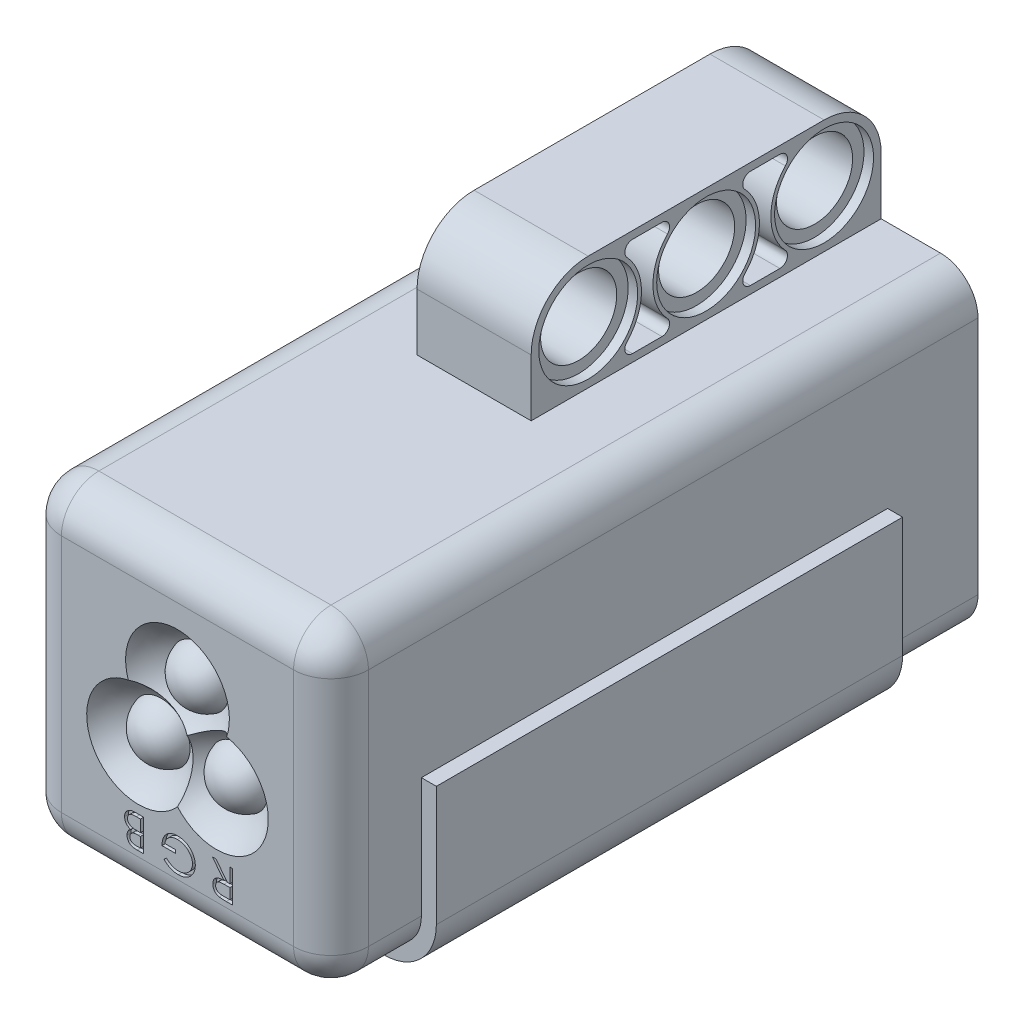
from build123d import *
from build123d.topology import SkipClean

# Parameters (mm, degrees)
SKETCH1_W                         = 20.5
SKETCH1_H                         = 21
BOSS_EXTRUDE1_DEPTH               = 21.6
FILLET1_R                         = 2.5
SKETCH2_W                         = 12.5
SKETCH2_H                         = 15
CUT_EXTRUDE1_DEPTH                = 12
BOSS_EXTRUDE5_DEPTH               = 15.565
CIRPATTERN1_COUNT                 = 3
CUT_EXTRUDE2_DEPTH                = 0.25
PROXIMITY_START                   = -1.992044947
PROXIMITY_SENSOR_PART_OUTLINE_R   = 2.54
PROXIMITY_SENSOR_PART_DEPTH       = 6.35
PROXIMITY_START_2                 = -2.627044947
PROXIMITY_SENSOR_PART_2_OUTLINE_R = 3.302
PROXIMITY_SENSOR_PART_2_DEPTH     = 7.62
BODY_MOVE_COPY4_START             = -11.585761931
BODY_MOVE_COPY4_DEPTH             = 23.368
BODY_MOVE_COPY4_START_2           = 3.783
BODY_MOVE_COPY4_2_DEPTH           = 7.999238069
BODY_MOVE_COPY4_3_DEPTH           = 7.748761931
BODY_MOVE_COPY4_START_3           = 3.148
BODY_MOVE_COPY4_4_DEPTH           = 0.635
BODY_MOVE_COPY4_START_4           = -3.837
BODY_MOVE_COPY4_5_DEPTH           = 0.635
BODY_MOVE_COPY4_START_5           = -3.202
BODY_MOVE_COPY4_6_OUTLINE_R       = 2.54
BODY_MOVE_COPY4_6_DEPTH           = 6.35
BODY_MOVE_COPY4_7_OUTLINE_R       = 3.302
BODY_MOVE_COPY4_7_DEPTH           = 7.62


# Read off the part's stored shape, not the designer's step: Proximity sensor - part, Body-Move/Copy4
with BuildPart() as part:
    # Sketch1 → Boss-Extrude1 (new, symmetric)
    with BuildSketch(Plane.XY):
        Rectangle(SKETCH1_W, SKETCH1_H)
    extrude(amount=BOSS_EXTRUDE1_DEPTH, both=True)

    # Fillet1
    fillet1_edges = [part.edges().sort_by_distance(p)[0] for p in [
        (-10.25, 0, 21.6),
        (0, -10.5, 21.6),
        (10.25, 0, 21.6),
        (0, 10.5, 21.6),
        (10.25, -10.5, 0),
        (-10.25, -10.5, 0),
        (-10.25, 10.5, 0),
        (10.25, 10.5, 0),
    ]]
    fillet(fillet1_edges, radius=FILLET1_R)

    # Sketch2 → Cut-Extrude1 (cut)
    with BuildSketch(Plane(origin=(0, 0, -21.6), x_dir=(-1, 0, 0), z_dir=(0, 0, -1))):
        with Locations((0, 1.5)):
            Rectangle(SKETCH2_W, SKETCH2_H)
    extrude(amount=-CUT_EXTRUDE1_DEPTH, mode=Mode.SUBTRACT)

    # Sketch5 → Boss-Extrude5 (add, symmetric)
    with BuildSketch(Plane.XY):
        with BuildLine():
            Line((10.25, -8), (10.25, 0))
            Line((10.25, 0), (11.25, 0))
            Line((11.25, 0), (11.25, -8))
            ThreePointArc((11.25, -8), (10.224873734, -10.474873734), (7.75, -11.5))
            Line((7.75, -11.5), (-7.75, -11.5))
            ThreePointArc((-7.75, -11.5), (-10.224873734, -10.474873734), (-11.25, -8))
            Line((-11.25, -8), (-11.25, 0))
            Line((-11.25, 0), (-10.25, 0))
            Line((-10.25, 0), (-10.25, -8))
            ThreePointArc((-10.25, -8), (-9.517766953, -9.767766953), (-7.75, -10.5))
            Line((-7.75, -10.5), (7.75, -10.5))
            ThreePointArc((7.75, -10.5), (9.517766953, -9.767766953), (10.25, -8))
        make_face()
    extrude(amount=BOSS_EXTRUDE5_DEPTH, both=True)

    # Sketch6 → Cut-Revolve1 (revolve, cut)
    with BuildSketch(Plane.XY.offset(23.6)):
        with BuildLine():
            Line((0, -1), (0, 7))
            ThreePointArc((0, 7), (-4, 3), (0, -1))
        make_face()
    cut_revolve1 = revolve(axis=Axis((0, -1, 23.6), (0, 1, 0)), mode=Mode.SUBTRACT)

    # Sketch7 → Revolve2 (revolve)
    with BuildSketch(Plane(origin=(0, 0, 0), x_dir=(0, 0, -1), z_dir=(1, 0, 0)), mode=Mode.PRIVATE) as revolve2_sk:
        with BuildLine():
            Line((-16.6, 3), (-21.6, 3))
            ThreePointArc((-21.6, 3), (-21.014213562, 4.414213562), (-19.6, 5))
            Line((-19.6, 5), (-16.6, 5))
            Line((-16.6, 5), (-16.6, 3))
        make_face()
    revolve2 = revolve(revolve2_sk.sketch.rotate(Axis((0, 3, 16.6), (0, 0, 1)), 90), axis=Axis((0, 3, 16.6), (0, 0, 1)))

    # CirPattern1: Cut-Revolve1, Revolve2 ×3 about axis
    cirpattern1_axis = Axis((0, 0, 0), (0, 0, 1))
    add([cut_revolve1.rotate(cirpattern1_axis, i * 360 / CIRPATTERN1_COUNT) for i in range(1, CIRPATTERN1_COUNT)], mode=Mode.SUBTRACT)
    add([revolve2.rotate(cirpattern1_axis, i * 360 / CIRPATTERN1_COUNT) for i in range(1, CIRPATTERN1_COUNT)])

    # Sketch8 → Cut-Extrude2 (cut)
    # profile 1 of 3: a face of its own
    with BuildSketch(Plane.XY.offset(21.6)):
        with BuildLine():
            Line((3.686256134, -7.638960054), (3.262668393, -7.638960054))
            add(Edge.make_bspline(
                [(3.262668393, -7.638960054), (3.234401139, -7.638865961), (3.180124881, -7.638685293), (3.102368665, -7.637677903), (3.031716087, -7.634790555), (2.968204089, -7.63230584), (2.911833836, -7.627774999), (2.862432474, -7.623444513), (2.820227533, -7.61777568), (2.794678852, -7.612510972), (2.783111102, -7.610127255)],
                knots=[0, 0, 0, 0, 1.410062039, 2.707475311, 3.878576406, 4.937260626, 5.877586885, 6.699081471, 7.410979367, 8, 8, 8, 8], degree=3))
            add(Edge.make_bspline(
                [(2.783111102, -7.610127255), (2.76762493, -7.606301492), (2.736982949, -7.598731579), (2.692869311, -7.582723674), (2.65081574, -7.564228768), (2.610976238, -7.542339896), (2.573361243, -7.517426679), (2.537974547, -7.489388965), (2.505290614, -7.457986528), (2.4741466, -7.42452018), (2.446951928, -7.387532838), (2.422469508, -7.348901512), (2.401917356, -7.307882452), (2.385745106, -7.264682548), (2.372187435, -7.219725571), (2.363075414, -7.172567284), (2.357400288, -7.123361117), (2.356839585, -7.08988072), (2.356555279, -7.072904365)],
                knots=[0, 0, 0, 0, 1.027276577, 2.032638556, 3.019345632, 3.985365262, 4.957888996, 5.923693931, 6.890056973, 7.876427719, 8.865527834, 9.843495157, 10.821038291, 11.815616373, 12.812734995, 13.843357168, 14.906466538, 16, 16, 16, 16], degree=3))
            add(Edge.make_bspline(
                [(2.356555279, -7.072904365), (2.35744365, -7.044701197), (2.359177092, -6.989669514), (2.375339739, -6.909804577), (2.401812932, -6.835302714), (2.438298498, -6.766267607), (2.484739933, -6.704008567), (2.540551978, -6.649509376), (2.605449603, -6.603482326), (2.666148681, -6.571903714), (2.719792504, -6.551584681), (2.764085066, -6.537216365), (2.812437452, -6.526302241), (2.864155973, -6.516382827), (2.919640108, -6.508813518), (2.978778126, -6.503437869), (3.041717934, -6.499981286), (3.084861505, -6.499476265), (3.10705608, -6.499216464)],
                knots=[0, 0, 0, 0, 1.260402266, 2.459371274, 3.627181936, 4.786749125, 5.93865593, 7.087644312, 8.261344208, 9.485713728, 10.136162886, 10.825977872, 11.566646758, 12.35154167, 13.181268117, 14.0701832, 15.007234106, 16, 16, 16, 16], degree=3))
            Line((3.10705608, -6.499216464), (2.329418527, -5.522293387))
            Line((2.329418527, -5.522293387), (2.564321038, -5.522293387))
            Line((2.564321038, -5.522293387), (3.341958591, -6.499216464))
            Line((3.341958591, -6.499216464), (3.496298869, -6.499216464))
            Line((3.496298869, -6.499216464), (3.496298869, -5.522293387))
            Line((3.496298869, -5.522293387), (3.686256134, -5.522293387))
            Line((3.686256134, -5.522293387), (3.686256134, -7.638960054))
        make_face()
        with BuildLine():
            Line((3.496298869, -7.421866037), (3.496298869, -6.716310481))
            Line((3.496298869, -6.716310481), (3.108752127, -6.713342399))
            add(Edge.make_bspline(
                [(3.108752127, -6.713342399), (3.090657625, -6.713334389), (3.055585327, -6.713318864), (3.004845432, -6.71573421), (2.957601259, -6.718481624), (2.914034107, -6.72268503), (2.874122555, -6.728099), (2.837892963, -6.734881709), (2.80526527, -6.742750427), (2.767333006, -6.755053775), (2.724488451, -6.773705721), (2.678886186, -6.802627184), (2.639008311, -6.83760343), (2.605854261, -6.878104047), (2.57922489, -6.922825098), (2.56072842, -6.97075448), (2.548539355, -7.021137018), (2.547195937, -7.055730678), (2.546512544, -7.073328376)],
                knots=[0, 0, 0, 0, 1.146399208, 2.222048177, 3.218135709, 4.144938032, 4.994811973, 5.769438708, 6.479732432, 7.119818093, 8.294689872, 9.430121864, 10.527913442, 11.641375077, 12.733452768, 13.811150417, 14.886538365, 16, 16, 16, 16], degree=3))
            add(Edge.make_bspline(
                [(2.546512544, -7.073328376), (2.547230539, -7.090353681), (2.548653345, -7.124091622), (2.560534344, -7.173371936), (2.579934135, -7.220231046), (2.606487469, -7.264024142), (2.639535941, -7.303482339), (2.678029968, -7.337140238), (2.7210637, -7.365102261), (2.760958769, -7.383551672), (2.796878382, -7.394407334), (2.827921743, -7.402287447), (2.863303906, -7.407806321), (2.902608428, -7.412882211), (2.94600797, -7.417180712), (2.993528982, -7.420033846), (3.045137483, -7.421739168), (3.080907284, -7.421822763), (3.099423869, -7.421866037)],
                knots=[0, 0, 0, 0, 1.100596872, 2.180981401, 3.259506136, 4.371595435, 5.481727359, 6.576991111, 7.667816242, 8.793363246, 9.406619729, 10.09427138, 10.864108636, 11.721733836, 12.6590937, 13.685439239, 14.801845161, 16, 16, 16, 16], degree=3))
            Line((3.099423869, -7.421866037), (3.496298869, -7.421866037))
        make_face(mode=Mode.SUBTRACT)
    # profile 2 of 3: a face of its own
    with BuildSketch(Plane.XY.offset(21.6)):
        with BuildLine():
            Line((-0.899854977, -7.277702041), (-0.737034465, -7.123361763))
            add(Edge.make_bspline(
                [(-0.737034465, -7.123361763), (-0.707398613, -7.151040463), (-0.648990924, -7.205590908), (-0.554221788, -7.277158634), (-0.455208135, -7.337989157), (-0.352754953, -7.387966069), (-0.248837924, -7.42681488), (-0.145531754, -7.454904619), (-0.043560717, -7.472969752), (0.024136732, -7.475091761), (0.057563559, -7.476139541)],
                knots=[0, 0, 0, 0, 1.091957225, 2.152079168, 3.193085318, 4.218301889, 5.218403563, 6.17723952, 7.099979378, 8, 8, 8, 8], degree=3))
            add(Edge.make_bspline(
                [(0.057563559, -7.476139541), (0.078073762, -7.475889038), (0.119040975, -7.475388683), (0.179895007, -7.469017441), (0.240102684, -7.459825671), (0.299456382, -7.446662968), (0.358192085, -7.429566843), (0.416179127, -7.408925822), (0.473305594, -7.384078435), (0.529270957, -7.35575014), (0.583804102, -7.324825145), (0.635092814, -7.290334619), (0.683350975, -7.253339937), (0.728237324, -7.213355922), (0.770366705, -7.171048061), (0.808967919, -7.12581521), (0.844885119, -7.078326857), (0.876774878, -7.02790229), (0.905598513, -6.97597424), (0.930557326, -6.922956641), (0.95204831, -6.869223416), (0.969220918, -6.814744273), (0.983027038, -6.759554001), (0.992799189, -6.703738829), (0.998287941, -6.647023756), (0.999239373, -6.609046622), (0.999717672, -6.589954979)],
                knots=[0, 0, 0, 0, 1.028307134, 2.053947307, 3.065600992, 4.082111276, 5.100671203, 6.132125737, 7.167228006, 8.222953114, 9.277225349, 10.309459149, 11.320441984, 12.324791754, 13.322338422, 14.312705492, 15.305176196, 16.306142747, 17.302479595, 18.282363326, 19.243345101, 20.20291386, 21.145121196, 22.094978082, 23.042318507, 24, 24, 24, 24], degree=3))
            add(Edge.make_bspline(
                [(0.999717672, -6.589954979), (0.999256273, -6.570440007), (0.998334733, -6.531463352), (0.992557797, -6.473271089), (0.981474952, -6.416061716), (0.967937392, -6.359295525), (0.948775345, -6.30369706), (0.926500061, -6.248452102), (0.899641063, -6.194074086), (0.868712328, -6.14094205), (0.834532755, -6.089236337), (0.796947369, -6.04012172), (0.755885186, -5.994172187), (0.712101154, -5.950715938), (0.665195799, -5.910027397), (0.614714194, -5.872596956), (0.561362948, -5.837845838), (0.505118404, -5.806155808), (0.446575045, -5.777848496), (0.386548536, -5.752675759), (0.324845948, -5.731944973), (0.26179186, -5.715049058), (0.197461353, -5.701199834), (0.131527912, -5.692290191), (0.064476321, -5.685824784), (0.019277244, -5.685352059), (-0.003494133, -5.6851139)],
                knots=[0, 0, 0, 0, 0.935896426, 1.86923723, 2.799743935, 3.728471844, 4.66505513, 5.616527375, 6.583419551, 7.570341864, 8.562833498, 9.553750335, 10.533080376, 11.5155245, 12.510142773, 13.507781369, 14.526649666, 15.561487327, 16.601173999, 17.643331812, 18.680652164, 19.71969803, 20.772446191, 21.833473655, 22.9085001, 24, 24, 24, 24], degree=3))
            add(Edge.make_bspline(
                [(-0.003494133, -5.6851139), (-0.030937341, -5.685687325), (-0.084826538, -5.686813338), (-0.164040561, -5.695585937), (-0.240127245, -5.709269561), (-0.312838859, -5.729371286), (-0.382439408, -5.754815052), (-0.448671736, -5.78628013), (-0.511720415, -5.823434408), (-0.571306276, -5.865529418), (-0.626035808, -5.912418867), (-0.675781864, -5.962606597), (-0.719086714, -6.016493059), (-0.756232775, -6.074066524), (-0.788204837, -6.134479245), (-0.813708531, -6.198766684), (-0.833434408, -6.266210785), (-0.841504025, -6.312836648), (-0.845581473, -6.336395951)],
                knots=[0, 0, 0, 0, 1.130234505, 2.219399076, 3.279128566, 4.311639422, 5.322903917, 6.328167287, 7.327698761, 8.334124803, 9.329374007, 10.292761544, 11.24113083, 12.171311216, 13.111441694, 14.052040787, 15.015727358, 16, 16, 16, 16], degree=3))
            Line((-0.845581473, -6.336395951), (-0.140025918, -6.336395951))
            Line((-0.140025918, -6.336395951), (-0.140025918, -6.553489968))
            Line((-0.140025918, -6.553489968), (-1.035538738, -6.553489968))
            add(Edge.make_bspline(
                [(-1.035538738, -6.553489968), (-1.034507106, -6.513026868), (-1.032488016, -6.433833271), (-1.018325148, -6.318341726), (-0.995455162, -6.209259798), (-0.964212973, -6.106472607), (-0.923769351, -6.010125815), (-0.874558346, -5.920121601), (-0.815792349, -5.837041417), (-0.749564606, -5.76020702), (-0.675239393, -5.69166983), (-0.594825037, -5.631431953), (-0.50818868, -5.580690847), (-0.415412273, -5.539409399), (-0.316799534, -5.507191317), (-0.212122276, -5.484348506), (-0.101522451, -5.470662766), (-0.025723603, -5.46891417), (0.013042325, -5.468019883)],
                knots=[0, 0, 0, 0, 1.140356446, 2.231883559, 3.274166699, 4.278491846, 5.25512956, 6.21435461, 7.1637429, 8.11826594, 9.068280886, 10.0076534, 10.945064095, 11.891975133, 12.864533718, 13.863980011, 14.907571808, 16, 16, 16, 16], degree=3))
            add(Edge.make_bspline(
                [(0.013042325, -5.468019883), (0.03693655, -5.468364066), (0.084063662, -5.469042905), (0.153666271, -5.473867301), (0.221349784, -5.481294126), (0.287104342, -5.49250951), (0.351171815, -5.506246467), (0.413232231, -5.523837007), (0.473521999, -5.544198554), (0.532134304, -5.567358318), (0.588537149, -5.594192606), (0.642981757, -5.624013197), (0.695769081, -5.656666325), (0.746539547, -5.692716693), (0.79555769, -5.731894657), (0.842507439, -5.774278742), (0.887651632, -5.819739371), (0.915930579, -5.852020963), (0.930179745, -5.868286977)],
                knots=[0, 0, 0, 0, 1.107784379, 2.184907829, 3.233506516, 4.263428166, 5.276301166, 6.270063455, 7.25232949, 8.225834625, 9.190232166, 10.146266622, 11.1027726, 12.066435141, 13.031522626, 14.010570082, 14.99756817, 16, 16, 16, 16], degree=3))
            add(Edge.make_bspline(
                [(0.930179745, -5.868286977), (0.950854094, -5.894092562), (0.99185962, -5.945275387), (1.044642124, -6.027281068), (1.089637258, -6.112190764), (1.126145417, -6.200240849), (1.154652736, -6.291348963), (1.17509747, -6.385398687), (1.187076164, -6.48251113), (1.188801875, -6.548227743), (1.189674937, -6.581474744)],
                knots=[0, 0, 0, 0, 1.023165419, 2.029347347, 3.013907458, 3.994755782, 4.975994455, 5.96558838, 6.970761222, 8, 8, 8, 8], degree=3))
            add(Edge.make_bspline(
                [(1.189674937, -6.581474744), (1.189352188, -6.606370264), (1.188710791, -6.655844896), (1.180967237, -6.729301499), (1.169790768, -6.801435609), (1.153602082, -6.872314017), (1.132301829, -6.941622052), (1.106721044, -7.009892274), (1.07675867, -7.076851811), (1.041793678, -7.141907182), (1.003734688, -7.20503614), (0.960937955, -7.264251688), (0.915780912, -7.320698808), (0.866100138, -7.372779373), (0.813757285, -7.422157149), (0.7574504, -7.467530687), (0.69810328, -7.509665524), (0.635236718, -7.547737151), (0.569847902, -7.581947419), (0.502077563, -7.611936351), (0.431950709, -7.636721697), (0.359991563, -7.6577515), (0.285655755, -7.673303052), (0.209482641, -7.684581099), (0.131075193, -7.692298225), (0.078076261, -7.692918865), (0.051203383, -7.693233558)],
                knots=[0, 0, 0, 0, 1.009025537, 2.005226976, 2.991671811, 3.967589759, 4.950148279, 5.929425679, 6.922109907, 7.921964004, 8.922507644, 9.908469609, 10.882248289, 11.851158214, 12.824245259, 13.798023939, 14.780666017, 15.773333703, 16.775582742, 17.771174102, 18.775387309, 19.789283316, 20.80873549, 21.851817535, 22.910773411, 24, 24, 24, 24], degree=3))
            add(Edge.make_bspline(
                [(0.051203383, -7.693233558), (0.029287713, -7.692883979), (-0.014168484, -7.692190806), (-0.078830748, -7.687361272), (-0.142366236, -7.679791343), (-0.205093669, -7.669206064), (-0.266774206, -7.655203457), (-0.327594719, -7.63813833), (-0.387440177, -7.618380211), (-0.446239383, -7.594797843), (-0.504392107, -7.568035863), (-0.562220498, -7.537910348), (-0.619527296, -7.503907678), (-0.67641179, -7.465926472), (-0.733232715, -7.424619173), (-0.789091331, -7.37880433), (-0.845335969, -7.330288664), (-0.881501828, -7.295404677), (-0.899854977, -7.277702041)],
                knots=[0, 0, 0, 0, 0.985875312, 1.954874891, 2.915472732, 3.863573565, 4.815313299, 5.759461513, 6.704487138, 7.649063459, 8.607849844, 9.583336382, 10.581114205, 11.603942397, 12.659508253, 13.739925933, 14.853076422, 16, 16, 16, 16], degree=3))
        make_face()
    # profile 3 of 3: a face of its own
    with BuildSketch(Plane.XY.offset(21.6)):
        with BuildLine():
            Line((-2.283829336, -7.638960054), (-2.696816783, -7.638960054))
            add(Edge.make_bspline(
                [(-2.696816783, -7.638960054), (-2.717033372, -7.63885544), (-2.756218153, -7.638652672), (-2.813194149, -7.635434895), (-2.866578678, -7.631157166), (-2.916277402, -7.623981504), (-2.962613703, -7.61654129), (-3.005117171, -7.605620836), (-3.044143825, -7.593558797), (-3.091006849, -7.574999714), (-3.14417937, -7.546177223), (-3.201329882, -7.503430729), (-3.251008593, -7.452181136), (-3.293250224, -7.393778182), (-3.327150031, -7.329528314), (-3.351364779, -7.260813889), (-3.366921255, -7.188790945), (-3.368501029, -7.139412558), (-3.369299422, -7.114457516)],
                knots=[0, 0, 0, 0, 1.00128172, 1.940733171, 2.826250472, 3.653024905, 4.427672124, 5.149348099, 5.824709082, 6.450061444, 7.643590664, 8.808605388, 9.972104426, 11.165284501, 12.367876273, 13.557044126, 14.765369432, 16, 16, 16, 16], degree=3))
            add(Edge.make_bspline(
                [(-3.369299422, -7.114457516), (-3.368647284, -7.091078938), (-3.367365771, -7.045137827), (-3.354846424, -6.978168895), (-3.335948774, -6.914219569), (-3.308678317, -6.853906125), (-3.273906192, -6.797758536), (-3.231600678, -6.746734537), (-3.181437933, -6.701835896), (-3.143775467, -6.676849164), (-3.124644641, -6.664157036)],
                knots=[0, 0, 0, 0, 1.044356178, 2.052258378, 3.035953355, 4.020338374, 5.002448483, 5.980768927, 6.974322109, 8, 8, 8, 8], degree=3))
            add(Edge.make_bspline(
                [(-3.124644641, -6.664157036), (-3.148691939, -6.654929485), (-3.194700378, -6.637274895), (-3.258095864, -6.605940894), (-3.312733804, -6.572121601), (-3.359318331, -6.535569131), (-3.398352874, -6.495089941), (-3.433126412, -6.451750079), (-3.462637644, -6.404040164), (-3.48781731, -6.352994048), (-3.507763606, -6.29888205), (-3.521609109, -6.242108995), (-3.530389972, -6.183317914), (-3.531538229, -6.14336043), (-3.532119935, -6.12311804)],
                knots=[0, 0, 0, 0, 1.272200328, 2.434034374, 3.488177493, 4.442517805, 5.351202203, 6.260825393, 7.183200622, 8.11705787, 9.069326169, 10.026320267, 11.000137371, 12, 12, 12, 12], degree=3))
            add(Edge.make_bspline(
                [(-3.532119935, -6.12311804), (-3.531529119, -6.102455252), (-3.530366672, -6.061800637), (-3.521791975, -6.002076802), (-3.507269205, -5.945004234), (-3.487279987, -5.890203033), (-3.461223035, -5.837994153), (-3.429743528, -5.787967291), (-3.391961482, -5.740863852), (-3.349415181, -5.696000307), (-3.30194575, -5.654974533), (-3.249638151, -5.619718333), (-3.193832973, -5.589266103), (-3.133766032, -5.564784218), (-3.069863542, -5.54561938), (-3.002110534, -5.532368842), (-2.930545481, -5.523404771), (-2.881432205, -5.522670134), (-2.856245202, -5.522293387)],
                knots=[0, 0, 0, 0, 0.978522333, 1.925270105, 2.85076145, 3.763600118, 4.682725947, 5.609499657, 6.557784645, 7.537954401, 8.534920712, 9.522742111, 10.520247711, 11.5409147, 12.58930695, 13.675078472, 14.807699069, 16, 16, 16, 16], degree=3))
            Line((-2.856245202, -5.522293387), (-2.283829336, -5.522293387))
            Line((-2.283829336, -5.522293387), (-2.283829336, -7.638960054))
        make_face()
        with BuildLine():
            Line((-2.473786601, -7.421866037), (-2.473786601, -6.743447233))
            Line((-2.473786601, -6.743447233), (-2.601414139, -6.743447233))
            add(Edge.make_bspline(
                [(-2.601414139, -6.743447233), (-2.620070483, -6.743687079), (-2.656118342, -6.744150509), (-2.708460056, -6.745519859), (-2.756924055, -6.749186189), (-2.801677328, -6.753063944), (-2.842419953, -6.759034869), (-2.879288213, -6.76634168), (-2.912613665, -6.774001504), (-2.951026619, -6.787065859), (-2.994593496, -6.8061715), (-3.040711844, -6.836547963), (-3.08222043, -6.87171734), (-3.116462618, -6.913433716), (-3.144970482, -6.958483631), (-3.16416372, -7.007203021), (-3.177545959, -7.057913004), (-3.178737291, -7.092885231), (-3.179342157, -7.110641411)],
                knots=[0, 0, 0, 0, 1.156584208, 2.234756387, 3.244705828, 4.168772894, 5.018724976, 5.795346628, 6.498686023, 7.135894168, 8.308330183, 9.43588092, 10.547699294, 11.667188675, 12.76860303, 13.837480448, 14.902040606, 16, 16, 16, 16], degree=3))
            add(Edge.make_bspline(
                [(-3.179342157, -7.110641411), (-3.179047154, -7.122396389), (-3.178468474, -7.145455063), (-3.173013027, -7.179050226), (-3.165484575, -7.211019545), (-3.153068283, -7.240501183), (-3.138358186, -7.268530362), (-3.119503355, -7.294221692), (-3.097762001, -7.318271155), (-3.072414306, -7.340034128), (-3.043563888, -7.35971748), (-3.010296833, -7.376102932), (-2.973517591, -7.390664482), (-2.932459201, -7.401702479), (-2.887939507, -7.411285217), (-2.839279298, -7.417328039), (-2.786771834, -7.421210043), (-2.750391413, -7.421642495), (-2.731585747, -7.421866037)],
                knots=[0, 0, 0, 0, 0.911412742, 1.787835618, 2.63643285, 3.453173233, 4.262886967, 5.08783453, 5.918594724, 6.773969545, 7.67442701, 8.62112486, 9.645634318, 10.739428598, 11.916091468, 13.177237585, 14.540865421, 16, 16, 16, 16], degree=3))
            Line((-2.731585747, -7.421866037), (-2.473786601, -7.421866037))
        make_face(mode=Mode.SUBTRACT)
        with BuildLine():
            Line((-2.473786601, -6.526353216), (-2.473786601, -5.739387404))
            Line((-2.473786601, -5.739387404), (-2.744306099, -5.739387404))
            add(Edge.make_bspline(
                [(-2.744306099, -5.739387404), (-2.76366799, -5.739641796), (-2.800985482, -5.740132102), (-2.85490652, -5.741295531), (-2.90461759, -5.74561185), (-2.950532588, -5.749750069), (-2.992439072, -5.756510711), (-3.030744652, -5.763057344), (-3.064574411, -5.772691039), (-3.104157183, -5.785947174), (-3.148430116, -5.807132234), (-3.196778248, -5.838286679), (-3.239362895, -5.87623509), (-3.275492984, -5.91993053), (-3.305533569, -5.966950481), (-3.326315721, -6.017387485), (-3.339781373, -6.069556865), (-3.341367306, -6.105228373), (-3.34216267, -6.12311804)],
                knots=[0, 0, 0, 0, 1.16016216, 2.236059617, 3.229676189, 4.14889023, 4.996733752, 5.772278665, 6.474820656, 7.101410824, 8.271817372, 9.403828207, 10.537358096, 11.673541442, 12.791884111, 13.865947414, 14.929748409, 16, 16, 16, 16], degree=3))
            add(Edge.make_bspline(
                [(-3.34216267, -6.12311804), (-3.342000312, -6.134303785), (-3.341678214, -6.156494849), (-3.336615165, -6.189076626), (-3.329588947, -6.220794061), (-3.319234275, -6.251216325), (-3.306707939, -6.280867285), (-3.290182509, -6.308782153), (-3.271541946, -6.33614922), (-3.242670534, -6.37115473), (-3.200104167, -6.411000133), (-3.139594574, -6.449523795), (-3.071177745, -6.481095136), (-3.021438881, -6.494441919), (-2.995745068, -6.501336523)],
                knots=[0, 0, 0, 0, 0.723354195, 1.435040621, 2.129761981, 2.824182007, 3.512608497, 4.209435533, 4.920062464, 5.654614313, 7.143585817, 8.671381114, 10.280521501, 12, 12, 12, 12], degree=3))
            add(Edge.make_bspline(
                [(-2.995745068, -6.501336523), (-2.985446529, -6.503426166), (-2.963117173, -6.507956945), (-2.926705737, -6.512736522), (-2.884997514, -6.517023958), (-2.838170772, -6.520112109), (-2.786039275, -6.523427186), (-2.728619771, -6.524670542), (-2.665871667, -6.526188124), (-2.622333369, -6.526296778), (-2.599718092, -6.526353216)],
                knots=[0, 0, 0, 0, 0.634452549, 1.375623993, 2.216454381, 3.166361212, 4.209414599, 5.370755378, 6.634280627, 8, 8, 8, 8], degree=3))
            Line((-2.599718092, -6.526353216), (-2.473786601, -6.526353216))
        make_face(mode=Mode.SUBTRACT)
    extrude(amount=-CUT_EXTRUDE2_DEPTH, mode=Mode.SUBTRACT)


with BuildPart() as body_2:
    # Proximity sensor - part outline → Proximity sensor - part (new body)
    with BuildSketch(Plane.XY.offset(PROXIMITY_START)):
        with BuildLine():
            ThreePointArc((7.972238069, 13.110678487), (10.666314905, 14.226601651), (11.782238069, 16.920678487))
            Line((11.782238069, 16.920678487), (11.782238069, 20.730678487))
            Line((11.782238069, 20.730678487), (-11.585761931, 20.730678487))
            Line((-11.585761931, 20.730678487), (-11.585761931, 16.920678487))
            ThreePointArc((-11.585761931, 16.920678487), (-10.469838768, 14.22660165), (-7.775761931, 13.110678487))
            Line((-7.775761931, 13.110678487), (7.972238069, 13.110678487))
        make_face()
        with BuildLine():
            Line((-4.824548622, 20.222678487), (-2.852975241, 20.222678487))
            ThreePointArc((-2.852975241, 20.222678487), (-2.386347445, 19.915483118), (-2.484073578, 19.365428487))
            ThreePointArc((-2.484073578, 19.365428487), (-3.457761931, 16.920678487), (-2.484073578, 14.475928487))
            ThreePointArc((-2.484073578, 14.475928487), (-2.386347445, 13.925873856), (-2.852975241, 13.618678487))
            Line((-2.852975241, 13.618678487), (-4.824548622, 13.618678487))
            ThreePointArc((-4.824548622, 13.618678487), (-5.291176418, 13.925873856), (-5.193450285, 14.475928487))
            ThreePointArc((-5.193450285, 14.475928487), (-4.219761931, 16.920678487), (-5.193450285, 19.365428487))
            ThreePointArc((-5.193450285, 19.365428487), (-5.291176418, 19.915483118), (-4.824548622, 20.222678487))
        make_face(mode=Mode.SUBTRACT)
        with BuildLine():
            Line((3.049451378, 20.222678487), (5.021024759, 20.222678487))
            ThreePointArc((5.021024759, 20.222678487), (5.487652555, 19.915483118), (5.389926422, 19.365428487))
            ThreePointArc((5.389926422, 19.365428487), (4.416238069, 16.920678487), (5.389926422, 14.475928487))
            ThreePointArc((5.389926422, 14.475928487), (5.487652555, 13.925873856), (5.021024759, 13.618678487))
            Line((5.021024759, 13.618678487), (3.049451378, 13.618678487))
            ThreePointArc((3.049451378, 13.618678487), (2.582823582, 13.925873856), (2.680549715, 14.475928487))
            ThreePointArc((2.680549715, 14.475928487), (3.654238069, 16.920678487), (2.680549715, 19.365428487))
            ThreePointArc((2.680549715, 19.365428487), (2.582823582, 19.915483118), (3.049451378, 20.222678487))
        make_face(mode=Mode.SUBTRACT)
        with Locations((-7.775761931, 16.920678487)):
            Circle(PROXIMITY_SENSOR_PART_OUTLINE_R, mode=Mode.SUBTRACT)
        with Locations((0.098238069, 16.920678487)):
            Circle(PROXIMITY_SENSOR_PART_OUTLINE_R, mode=Mode.SUBTRACT)
        with Locations((7.972238069, 16.920678487)):
            Circle(PROXIMITY_SENSOR_PART_OUTLINE_R, mode=Mode.SUBTRACT)
    extrude(amount=PROXIMITY_SENSOR_PART_DEPTH)

    # Proximity sensor - part 2 outline → Proximity sensor - part 2 (add)
    with BuildSketch(Plane.XY.offset(PROXIMITY_START_2)):
        with BuildLine():
            ThreePointArc((7.972238069, 13.110678487), (10.666314905, 14.226601651), (11.782238069, 16.920678487))
            Line((11.782238069, 16.920678487), (11.782238069, 20.730678487))
            Line((11.782238069, 20.730678487), (-11.585761931, 20.730678487))
            Line((-11.585761931, 20.730678487), (-11.585761931, 16.920678487))
            ThreePointArc((-11.585761931, 16.920678487), (-10.469838768, 14.22660165), (-7.775761931, 13.110678487))
            Line((-7.775761931, 13.110678487), (7.972238069, 13.110678487))
        make_face()
        with Locations((-7.775761931, 16.920678487)):
            Circle(PROXIMITY_SENSOR_PART_2_OUTLINE_R, mode=Mode.SUBTRACT)
        with BuildLine():
            Line((-4.824548622, 20.222678487), (-2.852975241, 20.222678487))
            ThreePointArc((-2.852975241, 20.222678487), (-2.386347445, 19.915483118), (-2.484073578, 19.365428487))
            ThreePointArc((-2.484073578, 19.365428487), (-3.457761931, 16.920678487), (-2.484073578, 14.475928487))
            ThreePointArc((-2.484073578, 14.475928487), (-2.386347445, 13.925873856), (-2.852975241, 13.618678487))
            Line((-2.852975241, 13.618678487), (-4.824548622, 13.618678487))
            ThreePointArc((-4.824548622, 13.618678487), (-5.291176418, 13.925873856), (-5.193450285, 14.475928487))
            ThreePointArc((-5.193450285, 14.475928487), (-4.219761931, 16.920678487), (-5.193450285, 19.365428487))
            ThreePointArc((-5.193450285, 19.365428487), (-5.291176418, 19.915483118), (-4.824548622, 20.222678487))
        make_face(mode=Mode.SUBTRACT)
        with Locations((0.098238069, 16.920678487)):
            Circle(PROXIMITY_SENSOR_PART_2_OUTLINE_R, mode=Mode.SUBTRACT)
        with BuildLine():
            Line((3.049451378, 20.222678487), (5.021024759, 20.222678487))
            ThreePointArc((5.021024759, 20.222678487), (5.487652555, 19.915483118), (5.389926422, 19.365428487))
            ThreePointArc((5.389926422, 19.365428487), (4.416238069, 16.920678487), (5.389926422, 14.475928487))
            ThreePointArc((5.389926422, 14.475928487), (5.487652555, 13.925873856), (5.021024759, 13.618678487))
            Line((5.021024759, 13.618678487), (3.049451378, 13.618678487))
            ThreePointArc((3.049451378, 13.618678487), (2.582823582, 13.925873856), (2.680549715, 14.475928487))
            ThreePointArc((2.680549715, 14.475928487), (3.654238069, 16.920678487), (2.680549715, 19.365428487))
            ThreePointArc((2.680549715, 19.365428487), (2.582823582, 19.915483118), (3.049451378, 20.222678487))
        make_face(mode=Mode.SUBTRACT)
        with Locations((7.972238069, 16.920678487)):
            Circle(PROXIMITY_SENSOR_PART_2_OUTLINE_R, mode=Mode.SUBTRACT)
    extrude(amount=PROXIMITY_SENSOR_PART_2_DEPTH)

    # Body-Move/Copy4 outline → Body-Move/Copy4 (cut)
    with BuildSketch(Plane.YZ.offset(BODY_MOVE_COPY4_START)):
        with BuildLine():
            ThreePointArc((14.31, 1.768), (17.004076836, 0.652076836), (18.12, -2.042))
            Line((18.12, -2.042), (18.12, -2.627044947))
            Line((18.12, -2.627044947), (20.730678487, -2.627044947))
            Line((20.730678487, -2.627044947), (20.730678487, 4.992955053))
            Line((20.730678487, 4.992955053), (13.110678487, 4.992955053))
            Line((13.110678487, 4.992955053), (13.110678487, 1.768))
            Line((13.110678487, 1.768), (14.31, 1.768))
        make_face()
        with BuildLine():
            Line((13.110678487, 0.197023874), (13.110678487, -2.627044947))
            Line((13.110678487, -2.627044947), (16.781704353, -2.627044947))
            ThreePointArc((16.781704353, -2.627044947), (15.858735193, -0.028788809), (13.110678487, 0.197023874))
        make_face()
    extrude(amount=BODY_MOVE_COPY4_DEPTH, mode=Mode.SUBTRACT)

    # Body-Move_Copy4 2 outline → Body-Move_Copy4 2 (cut)
    with BuildSketch(Plane.YZ.offset(BODY_MOVE_COPY4_START_2)):
        with BuildLine():
            Line((14.31, 1.768), (13.110678487, 1.768))
            Line((13.110678487, 1.768), (13.110678487, 0.197023874))
            ThreePointArc((13.110678487, 0.197023874), (15.858735193, -0.028788809), (16.781704353, -2.627044947))
            Line((16.781704353, -2.627044947), (18.12, -2.627044947))
            Line((18.12, -2.627044947), (18.12, -2.042))
            ThreePointArc((18.12, -2.042), (17.004076836, 0.652076836), (14.31, 1.768))
        make_face()
    extrude(amount=BODY_MOVE_COPY4_2_DEPTH, mode=Mode.SUBTRACT)

    # Body-Move_Copy4 3 outline → Body-Move_Copy4 3 (cut)
    with BuildSketch(Plane.YZ.offset(BODY_MOVE_COPY4_START)):
        with BuildLine():
            Line((14.31, 1.768), (13.110678487, 1.768))
            Line((13.110678487, 1.768), (13.110678487, 0.197023874))
            ThreePointArc((13.110678487, 0.197023874), (15.858735193, -0.028788809), (16.781704353, -2.627044947))
            Line((16.781704353, -2.627044947), (18.12, -2.627044947))
            Line((18.12, -2.627044947), (18.12, -2.042))
            ThreePointArc((18.12, -2.042), (17.004076836, 0.652076836), (14.31, 1.768))
        make_face()
    extrude(amount=BODY_MOVE_COPY4_3_DEPTH, mode=Mode.SUBTRACT)

    # Body-Move_Copy4 4 outline → Body-Move_Copy4 4 (cut)
    with BuildSketch(Plane.YZ.offset(BODY_MOVE_COPY4_START_3)):
        with BuildLine():
            Line((16.781704353, -2.627044947), (17.5597579, -2.627044947))
            ThreePointArc((17.5597579, -2.627044947), (16.408283618, 0.507590135), (13.110678487, 1.034496694))
            Line((13.110678487, 1.034496694), (13.110678487, 0.197023874))
            ThreePointArc((13.110678487, 0.197023874), (15.858735193, -0.028788809), (16.781704353, -2.627044947))
        make_face()
    extrude(amount=BODY_MOVE_COPY4_4_DEPTH, mode=Mode.SUBTRACT)

    # Body-Move_Copy4 5 outline → Body-Move_Copy4 5 (cut)
    with BuildSketch(Plane.YZ.offset(BODY_MOVE_COPY4_START_4)):
        with BuildLine():
            Line((16.781704353, -2.627044947), (17.5597579, -2.627044947))
            ThreePointArc((17.5597579, -2.627044947), (16.408283618, 0.507590135), (13.110678487, 1.034496694))
            Line((13.110678487, 1.034496694), (13.110678487, 0.197023874))
            ThreePointArc((13.110678487, 0.197023874), (15.858735193, -0.028788809), (16.781704353, -2.627044947))
        make_face()
    extrude(amount=BODY_MOVE_COPY4_5_DEPTH, mode=Mode.SUBTRACT)

    # Body-Move_Copy4 6 outline → Body-Move_Copy4 6 (add)
    with SkipClean():  # the faces are left unmerged after this step: merging them gives an invalid solid
        with BuildSketch(Plane.YZ.offset(BODY_MOVE_COPY4_START_5)):
            with BuildLine():
                Line((14.31, 1.768), (13.618678487, 1.768))
                Line((13.618678487, 1.768), (13.618678487, 0.402110179))
                ThreePointArc((13.618678487, 0.402110179), (15.2608669, -4.397302982), (13.110678487, 0.197023874))
                Line((13.110678487, 0.197023874), (13.110678487, 1.768))
                Line((13.110678487, 1.768), (10.5, 1.768))
                Line((10.5, 1.768), (10.5, -21.6))
                Line((10.5, -21.6), (14.31, -21.6))
                ThreePointArc((14.31, -21.6), (17.004076836, -20.484076836), (18.12, -17.79))
                Line((18.12, -17.79), (18.12, -2.042))
                ThreePointArc((18.12, -2.042), (17.004076836, 0.652076836), (14.31, 1.768))
            make_face()
            with BuildLine():
                ThreePointArc((11.008, -4.99321331), (11.315195369, -4.526585514), (11.86525, -4.624311646))
                ThreePointArc((11.86525, -4.624311646), (14.31, -5.598), (16.75475, -4.624311646))
                ThreePointArc((16.75475, -4.624311646), (17.304804631, -4.526585514), (17.612, -4.99321331))
                Line((17.612, -4.99321331), (17.612, -6.96478669))
                ThreePointArc((17.612, -6.96478669), (17.304804631, -7.431414486), (16.75475, -7.333688354))
                ThreePointArc((16.75475, -7.333688354), (14.31, -6.36), (11.86525, -7.333688354))
                ThreePointArc((11.86525, -7.333688354), (11.315195369, -7.431414486), (11.008, -6.96478669))
                Line((11.008, -6.96478669), (11.008, -4.99321331))
            make_face(mode=Mode.SUBTRACT)
            with BuildLine():
                Line((11.008, -14.83878669), (11.008, -12.86721331))
                ThreePointArc((11.008, -12.86721331), (11.315195369, -12.400585514), (11.86525, -12.498311646))
                ThreePointArc((11.86525, -12.498311646), (14.31, -13.472), (16.75475, -12.498311646))
                ThreePointArc((16.75475, -12.498311646), (17.304804631, -12.400585514), (17.612, -12.86721331))
                Line((17.612, -12.86721331), (17.612, -14.83878669))
                ThreePointArc((17.612, -14.83878669), (17.304804631, -15.305414486), (16.75475, -15.207688354))
                ThreePointArc((16.75475, -15.207688354), (14.31, -14.234), (11.86525, -15.207688354))
                ThreePointArc((11.86525, -15.207688354), (11.315195369, -15.305414486), (11.008, -14.83878669))
            make_face(mode=Mode.SUBTRACT)
            with Locations((14.31, -17.79)):
                Circle(BODY_MOVE_COPY4_6_OUTLINE_R, mode=Mode.SUBTRACT)
            with Locations((14.31, -9.916)):
                Circle(BODY_MOVE_COPY4_6_OUTLINE_R, mode=Mode.SUBTRACT)
        extrude(amount=BODY_MOVE_COPY4_6_DEPTH)

    # Body-Move_Copy4 7 outline → Body-Move_Copy4 7 (add)
    with SkipClean():  # the faces are left unmerged after this step: merging them gives an invalid solid
        with BuildSketch(Plane.YZ.offset(BODY_MOVE_COPY4_START_4)):
            with BuildLine():
                Line((14.31, 1.768), (13.618678487, 1.768))
                Line((13.618678487, 1.768), (13.618678487, 1.186819996))
                ThreePointArc((13.618678487, 1.186819996), (15.258384606, -5.204873795), (13.110678487, 1.034496694))
                Line((13.110678487, 1.034496694), (13.110678487, 1.768))
                Line((13.110678487, 1.768), (10.5, 1.768))
                Line((10.5, 1.768), (10.5, -21.6))
                Line((10.5, -21.6), (14.31, -21.6))
                ThreePointArc((14.31, -21.6), (17.004076836, -20.484076836), (18.12, -17.79))
                Line((18.12, -17.79), (18.12, -2.042))
                ThreePointArc((18.12, -2.042), (17.004076836, 0.652076836), (14.31, 1.768))
            make_face()
            with BuildLine():
                ThreePointArc((11.008, -4.99321331), (11.315195369, -4.526585514), (11.86525, -4.624311646))
                ThreePointArc((11.86525, -4.624311646), (14.31, -5.598), (16.75475, -4.624311646))
                ThreePointArc((16.75475, -4.624311646), (17.304804631, -4.526585514), (17.612, -4.99321331))
                Line((17.612, -4.99321331), (17.612, -6.96478669))
                ThreePointArc((17.612, -6.96478669), (17.304804631, -7.431414486), (16.75475, -7.333688354))
                ThreePointArc((16.75475, -7.333688354), (14.31, -6.36), (11.86525, -7.333688354))
                ThreePointArc((11.86525, -7.333688354), (11.315195369, -7.431414486), (11.008, -6.96478669))
                Line((11.008, -6.96478669), (11.008, -4.99321331))
            make_face(mode=Mode.SUBTRACT)
            with Locations((14.31, -17.79)):
                Circle(BODY_MOVE_COPY4_7_OUTLINE_R, mode=Mode.SUBTRACT)
            with BuildLine():
                Line((11.008, -14.83878669), (11.008, -12.86721331))
                ThreePointArc((11.008, -12.86721331), (11.315195369, -12.400585514), (11.86525, -12.498311646))
                ThreePointArc((11.86525, -12.498311646), (14.31, -13.472), (16.75475, -12.498311646))
                ThreePointArc((16.75475, -12.498311646), (17.304804631, -12.400585514), (17.612, -12.86721331))
                Line((17.612, -12.86721331), (17.612, -14.83878669))
                ThreePointArc((17.612, -14.83878669), (17.304804631, -15.305414486), (16.75475, -15.207688354))
                ThreePointArc((16.75475, -15.207688354), (14.31, -14.234), (11.86525, -15.207688354))
                ThreePointArc((11.86525, -15.207688354), (11.315195369, -15.305414486), (11.008, -14.83878669))
            make_face(mode=Mode.SUBTRACT)
            with Locations((14.31, -9.916)):
                Circle(BODY_MOVE_COPY4_7_OUTLINE_R, mode=Mode.SUBTRACT)
        extrude(amount=BODY_MOVE_COPY4_7_DEPTH)


solid = Compound([part.part, body_2.part])
